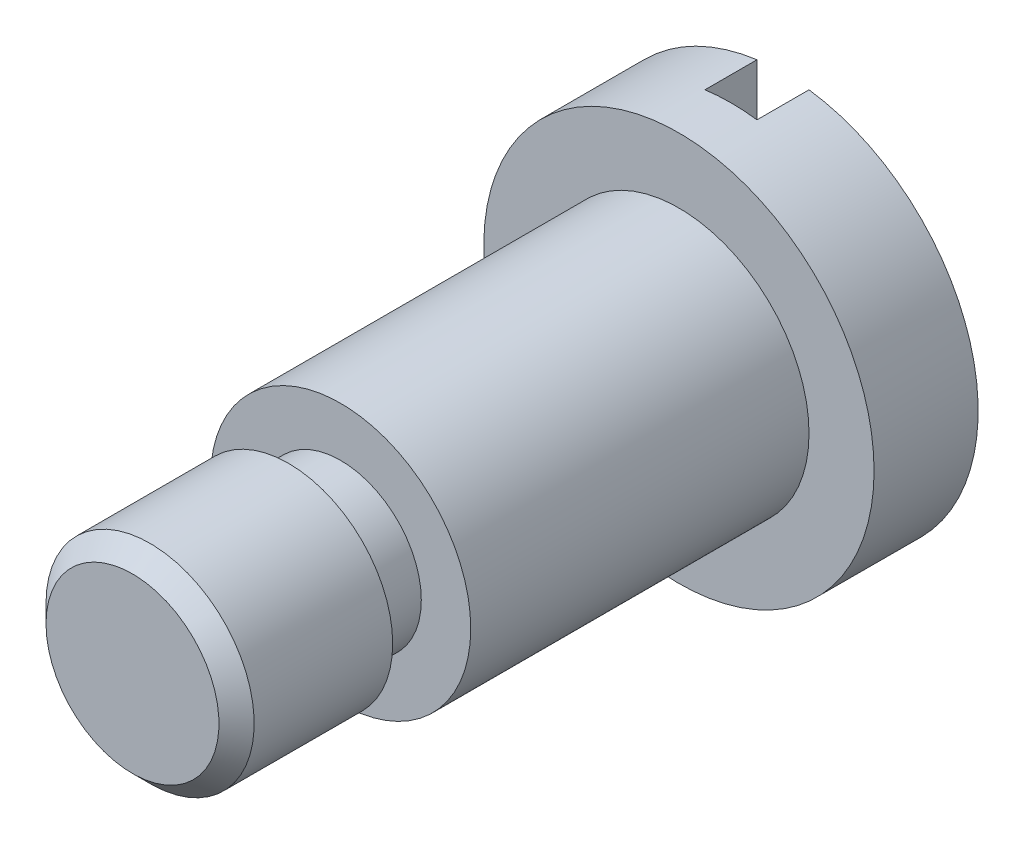
from build123d import *

# Parameters (mm, degrees)
SKETCH_1_R          = 7.5
EXTRUDE_1_DEPTH     = 4
SKETCH_2_R          = 5
EXTRUDE_2_DEPTH     = 13
SKETCH_3_R          = 3.1
EXTRUDE_3_DEPTH     = 2
SKETCH_4_R          = 4
EXTRUDE_4_DEPTH     = 6
SKETCH_6_W          = 2
SKETCH_6_H          = 15.894764062
CUT_EXTRUDE_2_DEPTH = 2


# Read off the part's stored shape, not the designer's step: M8 机械螺纹 螺柱1
with BuildPart() as part:
    # 草图1 → 凸台-拉伸1 (new body)
    with BuildSketch(Plane.XY):
        Circle(SKETCH_1_R)
    extrude(amount=EXTRUDE_1_DEPTH)

    # 草图2 → 凸台-拉伸2 (add)
    with BuildSketch(Plane.XY.offset(4)):
        with Locations(Location((0, 0, 0), (0, 0, 180))):
            Circle(SKETCH_2_R)
    extrude(amount=EXTRUDE_2_DEPTH)

    # 草图3 → 凸台-拉伸3 (add)
    with BuildSketch(Plane.XY.offset(17)):
        Circle(SKETCH_3_R)
    extrude(amount=EXTRUDE_3_DEPTH)

    # 草图4 → 凸台-拉伸4 (add)
    with BuildSketch(Plane.XY.offset(19)):
        Circle(SKETCH_4_R)
    extrude(amount=EXTRUDE_4_DEPTH)

    # M8 机械螺纹 螺柱1 outline → M8 机械螺纹 螺柱1 (revolve, cut)
    with BuildSketch(Plane.XZ):
        Polygon((4, 25), (3.3235, 25), (4, 24.3235), align=None)
    revolve(axis=Axis((0, 0, 0), (0, 0, 1)), mode=Mode.SUBTRACT)

    # 草图6 → 切除-拉伸-薄壁2 (cut)
    with BuildSketch(Plane(origin=(0, 0, 0), x_dir=(-1, 0, 0), z_dir=(0, 0, -1))):
        with Locations((0, 0.006874898)):
            Rectangle(SKETCH_6_W, SKETCH_6_H)
    extrude(amount=-CUT_EXTRUDE_2_DEPTH, mode=Mode.SUBTRACT)


solid = part.part
